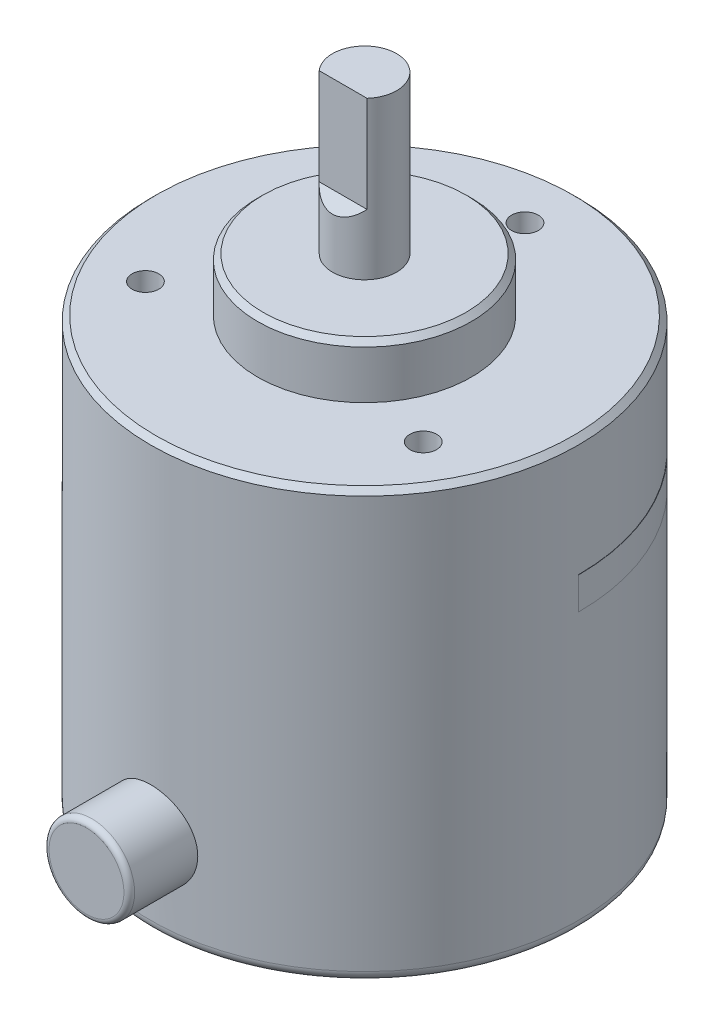
from build123d import *

# Parameters (mm, degrees)
SKETCH_2_W             = 16.970483697
SKETCH_2_H             = 5.016620159
CUT_EXTRUDE_1_DEPTH    = 10
CHAMFER_1_SIZE         = 1
SKETCH_3_R             = 4
EXTRUDE_1_DEPTH        = 26
FILLET_1_R             = 1
FILLET_2_R             = 0.5
CHAMFER_2_SIZE         = 0.5
HOLE_WIZARD_M3_1_D     = 2.5
HOLE_WIZARD_M3_1_DEPTH = 7.5
HOLE_WIZARD_M3_1_TIP   = 0.751075774
EXTRUDE_2_DEPTH        = 3


with BuildPart() as part:
    # 草图1 → 旋转1 (revolve)
    with BuildSketch(Plane.XY, mode=Mode.PRIVATE) as revolve_1_sk:
        Polygon((0, 0), (0, 59.7), (3, 59.7), (3, 45), (10, 45), (10, 40), (20, 40), (20, 0), align=None)
    revolve(revolve_1_sk.sketch.rotate(Axis((0, 0, 0), (0, 1, 0)), 90), axis=Axis((0, 0, 0), (0, 1, 0)))

    # 草图2 → 切除-拉伸1 (cut)
    with BuildSketch(Plane(origin=(0, 59.7, 0), x_dir=(1, 0, 0), z_dir=(0, 1, 0))):
        with Locations((-1.985722867, -4.50831008)):
            Rectangle(SKETCH_2_W, SKETCH_2_H)
    extrude(amount=-CUT_EXTRUDE_1_DEPTH, mode=Mode.SUBTRACT)

    # 倒角1
    chamfer_1_edges = [part.edges().sort_by_distance(p)[0] for p in [
        (0, 49.7, 2),
    ]]
    chamfer(chamfer_1_edges, length=CHAMFER_1_SIZE - 0.0001)  # a hair under: the kernel refuses the full size

    # 草图3 → 凸台-拉伸1 (add)
    with BuildSketch(Plane.XY):
        with Locations(Location((0, 8, 0), (0, 0, 180))):
            Circle(SKETCH_3_R)
    extrude(amount=EXTRUDE_1_DEPTH)

    # 圆角1
    fillet_1_edges = [part.edges().sort_by_distance(p)[0] for p in [
        (0, 0, 20),
    ]]
    fillet(fillet_1_edges, radius=FILLET_1_R)

    # 圆角2
    fillet_2_edges = [part.edges().sort_by_distance(p)[0] for p in [
        (4, 8, 26),
    ]]
    fillet(fillet_2_edges, radius=FILLET_2_R)

    # 倒角2
    chamfer_2_edges = [part.edges().sort_by_distance(p)[0] for p in [
        (0, 40, 20),
        (0, 45, 10),
    ]]
    chamfer(chamfer_2_edges, length=CHAMFER_2_SIZE)

    # M3 螺纹孔1
    with Locations(Plane(origin=(0, 40, 0), x_dir=(1, 0, 0), z_dir=(0, 1, 0))):
        with Locations((-12.990381057, -7.5), (12.990381057, -7.5), (0, 15)):
            Hole(HOLE_WIZARD_M3_1_D / 2, depth=HOLE_WIZARD_M3_1_DEPTH)
            with Locations((0, 0, -(HOLE_WIZARD_M3_1_DEPTH + HOLE_WIZARD_M3_1_TIP / 2))):  # 118° drill point
                Cone(0, HOLE_WIZARD_M3_1_D / 2, HOLE_WIZARD_M3_1_TIP, mode=Mode.SUBTRACT)

    # 草图8 → 凸台-拉伸2 (add)
    with BuildSketch(Plane(origin=(0, 29, 0), x_dir=(1, 0, 0), z_dir=(0, 1, 0))):
        with BuildLine():
            Line((20.025, 0), (-20.025, 0))
            ThreePointArc((-20.025, 0), (0, 20.025), (20.025, 0))
        make_face()
    extrude(amount=-EXTRUDE_2_DEPTH)


solid = part.part
